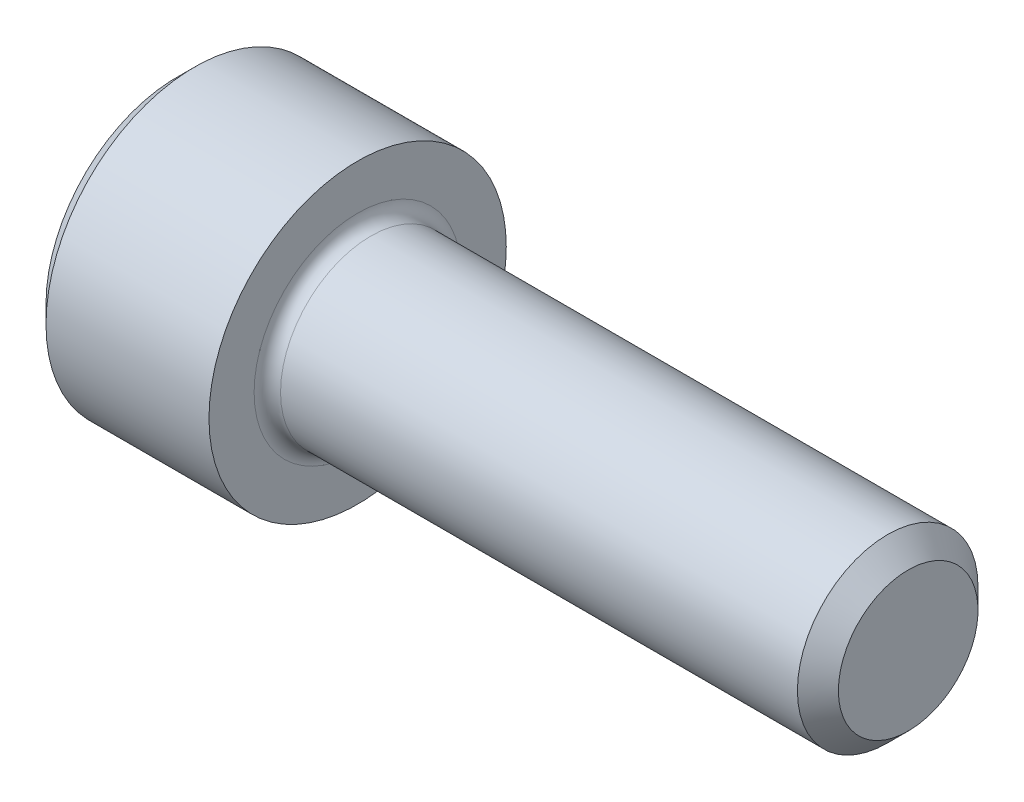
from build123d import *

# Parameters (mm, degrees)
FILLET1_R   = 0.3048
HEX_2_DEPTH = 1.9558


with BuildPart() as part:
    # BodySke → Base-Revolve (revolve)
    with BuildSketch(Plane.XY):
        Polygon((0, 0), (0, 3.0226), (0.4064, 3.429), (4.1656, 3.429), (4.1656, 2.0828), (16.39316, 2.0828), (16.8656, 1.61036), (16.8656, 0), align=None)
    revolve(axis=Axis((-31.75, 0, 0), (1, 0, 0)))

    # Fillet1
    fillet1_edges = [part.edges().sort_by_distance(p)[0] for p in [
        (4.1656, -2.0828, 0),
    ]]
    fillet(fillet1_edges, radius=FILLET1_R)

    # Sketch2 → Hex-PreBroach (revolve, cut)
    with BuildSketch(Plane.XY):
        Polygon((0, 1.778), (1.9558, 1.778), (2.982328779, 0), (0, 0), align=None)
    revolve(axis=Axis((0, 0, 0), (1, 0, 0)), mode=Mode.SUBTRACT)

    # Sketch3 → Hex 2 (cut)
    with BuildSketch(Plane(origin=(0, 0, 0), x_dir=(0, 0.500000000000001, 0.866025403784438), z_dir=(-1, 0, 0))):
        Polygon((1.026528779, 1.778), (-1.026528779, 1.778), (-2.053057557, 0), (-1.026528779, -1.778), (1.026528779, -1.778), (2.053057557, 0), align=None)
    extrude(amount=-HEX_2_DEPTH, mode=Mode.SUBTRACT)


solid = part.part
